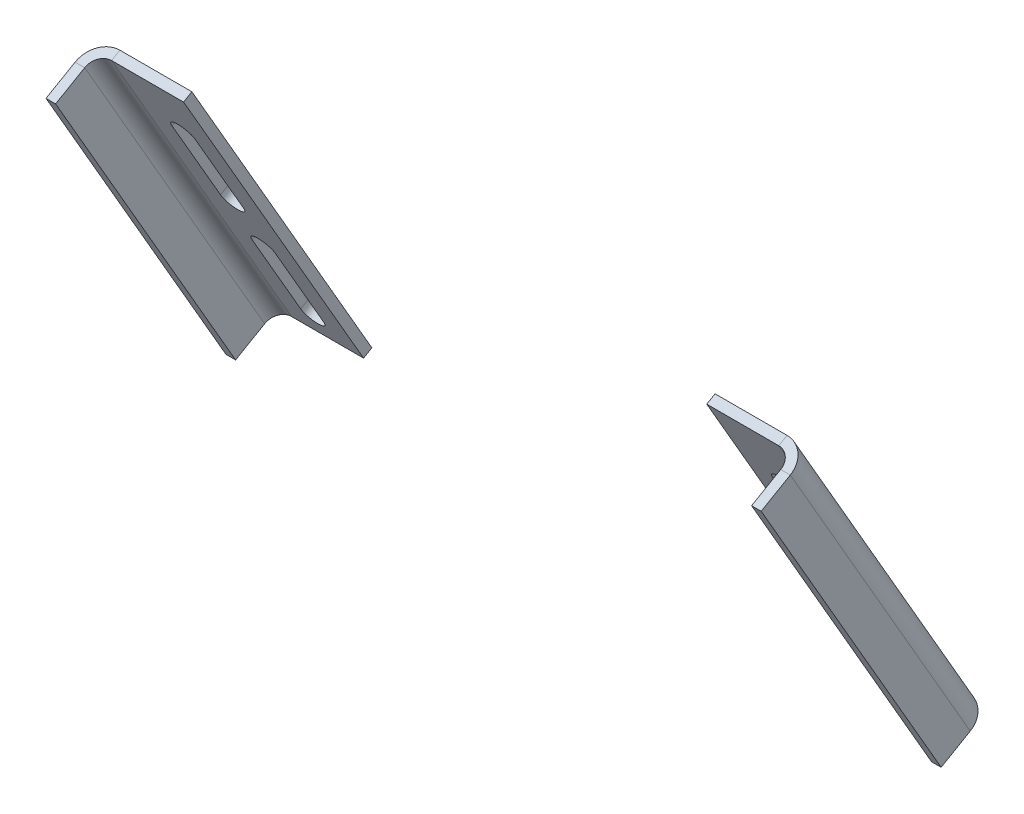
from build123d import *

# Parameters (mm, degrees)
SKETCH2_W              = 15
SKETCH2_H              = 75
BASE_FLANGE2_DEPTH     = 2
SM_EDGE_FLANGE_2_DEPTH = 75
SKETCH12_W             = 15
SKETCH12_H             = 75
BASE_FLANGE3_DEPTH     = 2
SM_EDGE_FLANGE_3_DEPTH = 75


# Sheet-metal steps are written as plain solids
with BuildPart() as part:
    # Sketch2 → Base-Flange2 (new body)
    with BuildSketch(Plane(origin=(1.391e-06, 487.685994213, -844.696920117), x_dir=(-1.0, 7.129193608778373e-10, -1.2348125547399519e-09), z_dir=(1.4258387217556799e-09, 0.4999999999999983, -0.8660254037844398))):
        with Locations((-62.000004193, 166.493857073)):
            Rectangle(SKETCH2_W, SKETCH2_H)
        with BuildLine():
            Line((-59.596560145, 186.593857073), (-59.596560145, 166.393857073))
            ThreePointArc((-59.596560145, 166.393857073), (-61.996560145, 163.993857073), (-64.396560145, 166.393857073))
            Line((-64.396560145, 166.393857073), (-64.396560145, 186.593857073))
            ThreePointArc((-64.396560145, 186.593857073), (-61.996560145, 188.993857073), (-59.596560145, 186.593857073))
        make_face(mode=Mode.SUBTRACT)
        with BuildLine():
            Line((-59.595570898, 155.593857073), (-59.595570898, 135.393857073))
            ThreePointArc((-59.595570898, 135.393857073), (-61.995570898, 132.993857073), (-64.395570898, 135.393857073))
            Line((-64.395570898, 135.393857073), (-64.395570898, 155.593857073))
            ThreePointArc((-64.395570898, 155.593857073), (-61.995570898, 157.993857073), (-59.595570898, 155.593857073))
        make_face(mode=Mode.SUBTRACT)
    extrude(amount=-BASE_FLANGE2_DEPTH)

    # 邊線-凸緣2 section (across the edge) → 邊線-凸緣2 (add)
    with BuildSketch(Plane(origin=(72.50000558, 598.397951319, -778.467940683), x_dir=(-1.0, 7.129173158057236e-10, -1.2348090125711463e-09), z_dir=(0, 0.8660254037844398, 0.49999999999999817))):
        with BuildLine():
            Line((-2, 3), (-2, 10))
            Line((-2, 10), (0, 10))
            Line((0, 10), (0, 3))
            ThreePointArc((0, 3), (0.878679656, 0.878679656), (3, 0))
            Line((3, 0), (3, -2))
            ThreePointArc((3, -2), (-0.535533906, -0.535533906), (-2, 3))
        make_face()
    extrude(amount=SM_EDGE_FLANGE_2_DEPTH)


with BuildPart() as body_2:
    # Sketch12 → Base-Flange3 (new body)
    with BuildSketch(Plane(origin=(1.391e-06, 487.685994213, -844.696920117), x_dir=(-1.0, 7.129193608778373e-10, -1.2348125547399519e-09), z_dir=(1.4258387217556799e-09, 0.4999999999999983, -0.8660254037844398))):
        with Locations((62.000003094, 166.493857379)):
            Rectangle(SKETCH12_W, SKETCH12_H)
        with BuildLine():
            Line((59.600003094, 155.593857379), (59.600003094, 135.393857379))
            ThreePointArc((59.600003094, 135.393857379), (62.000003094, 132.993857379), (64.400003094, 135.393857379))
            Line((64.400003094, 135.393857379), (64.400003094, 155.593857379))
            ThreePointArc((64.400003094, 155.593857379), (62.000003094, 157.993857379), (59.600003094, 155.593857379))
        make_face(mode=Mode.SUBTRACT)
        with BuildLine():
            Line((59.600003094, 188.993857379), (59.600003094, 168.793857379))
            ThreePointArc((59.600003094, 168.793857379), (62.000003094, 166.393857379), (64.400003094, 168.793857379))
            Line((64.400003094, 168.793857379), (64.400003094, 188.993857379))
            ThreePointArc((64.400003094, 188.993857379), (62.000003094, 191.393857379), (59.600003094, 188.993857379))
        make_face(mode=Mode.SUBTRACT)
    extrude(amount=-BASE_FLANGE3_DEPTH)

    # 邊線-凸緣3 section (across the edge) → 邊線-凸緣3 (add)
    with BuildSketch(Plane(origin=(-72.500001706, 663.349856971, -740.967940709), x_dir=(1.0, -7.1292094177144e-10, 1.2348149228536517e-09), z_dir=(0, -0.8660254037844398, -0.49999999999999817))):
        with BuildLine():
            Line((-2, 3), (-2, 10))
            Line((-2, 10), (0, 10))
            Line((0, 10), (0, 3))
            ThreePointArc((0, 3), (0.878679656, 0.878679656), (3, 0))
            Line((3, 0), (3, -2))
            ThreePointArc((3, -2), (-0.535533906, -0.535533906), (-2, 3))
        make_face()
    extrude(amount=SM_EDGE_FLANGE_3_DEPTH)


solid = Compound([part.part, body_2.part])
